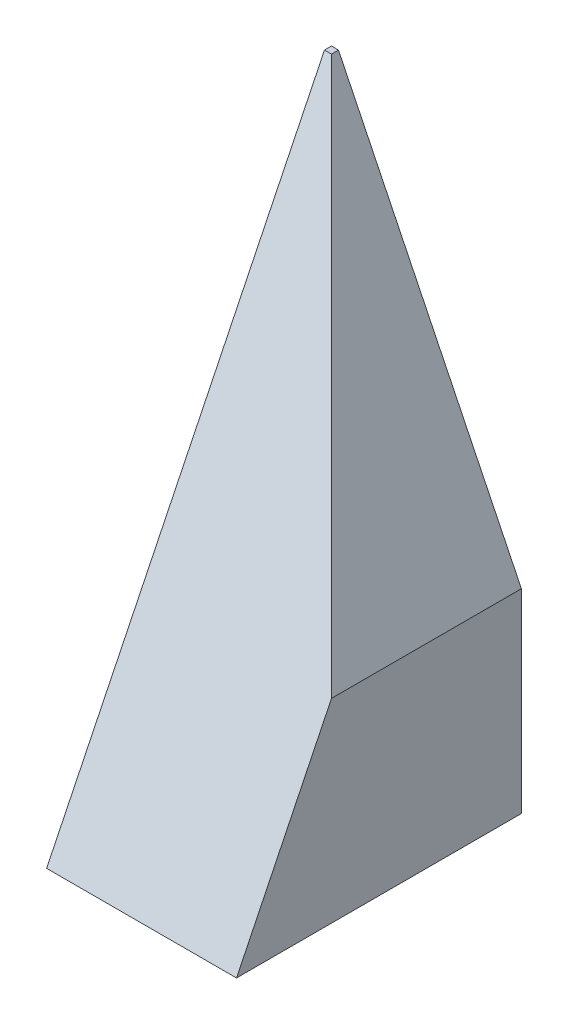
from build123d import *

# Parameters (mm, degrees)
SKETCH1_W           = 30
SKETCH1_H           = 30
BOSS_EXTRUDE1_DEPTH = 60
CHAMFER1_SIZE       = 60
CHAMFER1_SIZE_2     = 29.263955314
SKETCH2_W           = 10
SKETCH2_H           = 30
CUT_EXTRUDE1_DEPTH  = 101


with BuildPart() as part:
    # Sketch1 → Boss-Extrude1 (new body)
    with BuildSketch(Plane(origin=(0, 0, 0), x_dir=(1, 0, 0), z_dir=(0, 1, 0))):
        with Locations((15, -15)):
            Rectangle(SKETCH1_W, SKETCH1_H)
    extrude(amount=BOSS_EXTRUDE1_DEPTH)

    # Chamfer1
    # the kernel refuses this chamfer: 60, 29.263955314 mm, written as the material it takes off along each edge
    with BuildSketch(Plane(origin=(30, 60, -155.415022708), x_dir=(0.01692389084982915, -0.999856780703368, 0), z_dir=(0, 0, 1)), Plane(origin=(185.415022708, 60, 30), x_dir=(0, -0.999856780703368, 0.01692389084982915), z_dir=(-1, 0, 0))) as chamfer1_piece_1:
        Polygon((CHAMFER1_SIZE * 0.999856780703, -CHAMFER1_SIZE * 0.0169238908498), (-CHAMFER1_SIZE_2 * 0.0169238908498, -CHAMFER1_SIZE_2 * 0.999856780702), (0, 0), align=None)
    extrude(amount=340.830045416, mode=Mode.SUBTRACT)

    # Sketch2 → Cut-Extrude1 (cut)
    with BuildSketch(Plane(origin=(0, 0, 0), x_dir=(1, 0, 0), z_dir=(0, 1, 0))):
        with Locations((25, -15)):
            Rectangle(SKETCH2_W, SKETCH2_H)
    extrude(amount=CUT_EXTRUDE1_DEPTH, mode=Mode.SUBTRACT)


solid = part.part
